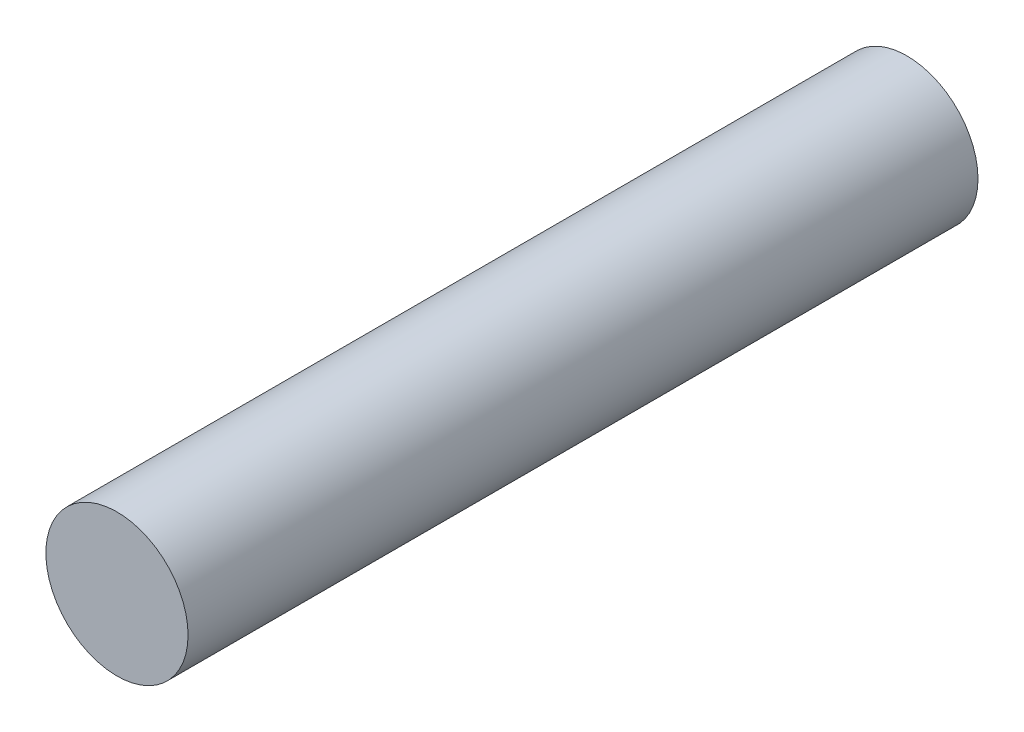
from build123d import *

# Parameters (mm, degrees)
BOSS_EXTRUDE1_DEPTH      = 15
BOSS_EXTRUDE1_DEPTH_BACK = 10
SKETCH1_R                = 2.25


with BuildPart() as part:
    # Sketch1 → Boss-Extrude1 (new, two sides: drawn at the far end of the back side and taken through both)
    with BuildSketch(Plane.XY.offset(-BOSS_EXTRUDE1_DEPTH_BACK)):
        Circle(SKETCH1_R)
    extrude(amount=BOSS_EXTRUDE1_DEPTH + BOSS_EXTRUDE1_DEPTH_BACK)


solid = part.part
